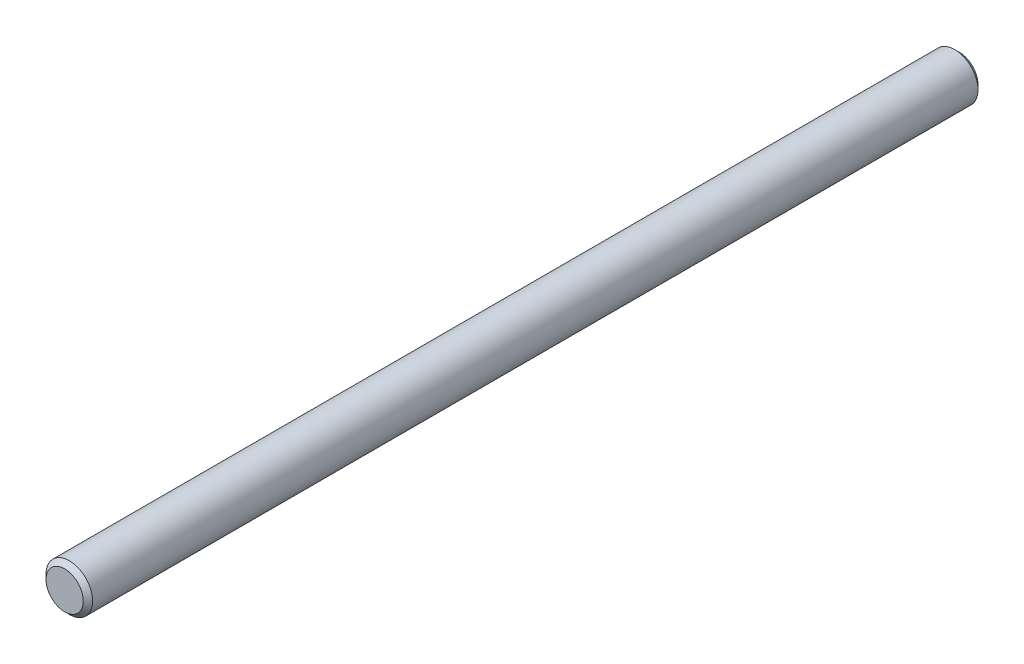
from build123d import *

# Parameters (mm, degrees)
SKETCH1_R      = 7.9375
EXTRUDE1_DEPTH = 152.4
CHAMFER1_SIZE  = 1.5875


with BuildPart() as part:
    # Sketch1 → Extrude1 (new, symmetric)
    with BuildSketch(Plane.XY):
        Circle(SKETCH1_R)
    extrude(amount=EXTRUDE1_DEPTH, both=True)

    # Chamfer1
    chamfer1_edges = [part.edges().sort_by_distance(p)[0] for p in [
        (-7.9375, 0, -152.4),
        (-7.9375, 0, 152.4),
    ]]
    chamfer(chamfer1_edges, length=CHAMFER1_SIZE)


solid = part.part
